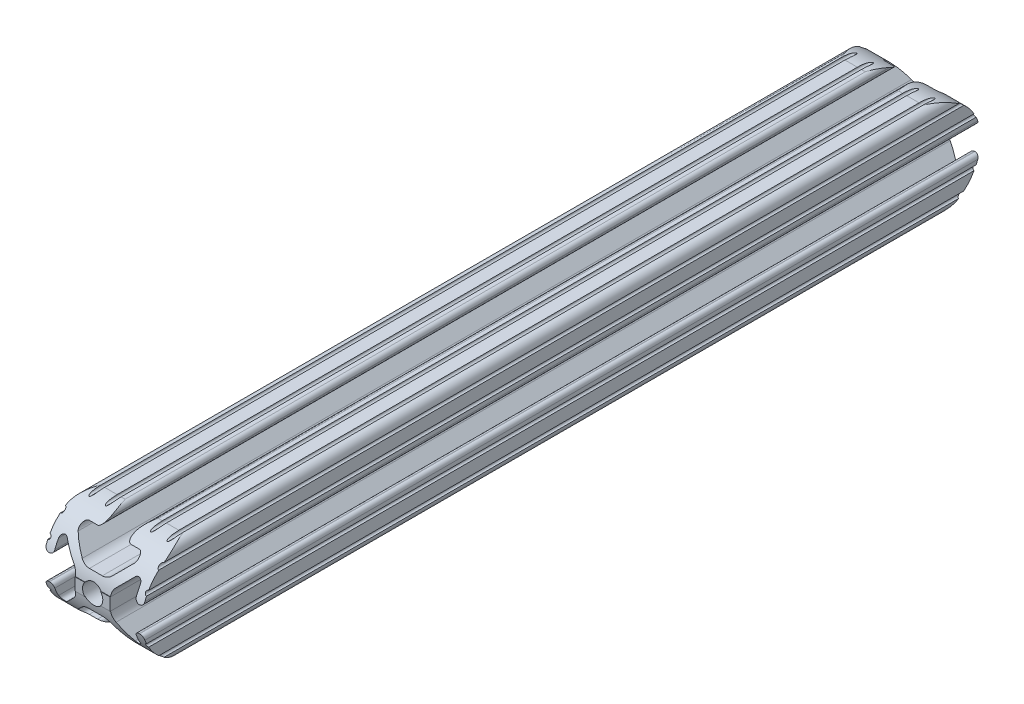
from build123d import *

# Parameters (mm, degrees)
SKETCH1_R               = 2.6035
BOSS_EXTRUDE1_DEPTH     = 107.95
CUT_EXTRUDE1_DEPTH      = 111.048284731
CUT_EXTRUDE1_DEPTH_BACK = 111.048284731
SKETCH2_R               = 3.175
CUT_EXTRUDE2_DEPTH      = 111.048284856
CUT_EXTRUDE2_DEPTH_BACK = 111.048284856


with BuildPart() as part:
    # Sketch1 → Boss-Extrude1 (new, symmetric)
    with BuildSketch(Plane.XY):
        with BuildLine():
            Line((-7.179650497, -8.645192506), (-3.952270251, -5.423690499))
            ThreePointArc((-3.952270251, -5.423690499), (-2.922936451, -4.736929036), (-1.709253557, -4.4958))
            Line((-1.709253557, -4.4958), (1.709253557, -4.4958))
            ThreePointArc((1.709253557, -4.4958), (2.922936451, -4.736929036), (3.952270251, -5.423690499))
            Line((3.952270251, -5.423690499), (7.179650497, -8.645192506))
            ThreePointArc((7.179650497, -8.645192506), (7.41473083, -9.822813117), (6.416408329, -10.4902))
            Line((6.416408329, -10.4902), (4.287512407, -10.4902))
            ThreePointArc((4.287512407, -10.4902), (3.54574862, -10.79744862), (3.2385, -11.539212407))
            Line((3.2385, -11.539212407), (3.2385, -11.650987593))
            ThreePointArc((3.2385, -11.650987593), (3.54574862, -12.39275138), (4.287512407, -12.7))
            Line((4.287512407, -12.7), (5.317126718, -12.7))
            ThreePointArc((5.317126718, -12.7), (5.825126718, -12.192), (6.333126718, -12.7))
            Line((6.333126718, -12.7), (9.550443118, -12.7))
            ThreePointArc((9.550443118, -12.7), (10.058366869, -12.192000006), (10.566443095, -12.699847501))
            ThreePointArc((10.566443095, -12.699847501), (12.082537762, -12.08250727), (12.699846982, -10.566399977))
            ThreePointArc((12.699846982, -10.566399977), (12.192000006, -10.058323491), (12.7, -9.5504))
            Line((12.7, -9.5504), (12.7, -6.3330836))
            ThreePointArc((12.7, -6.3330836), (12.192, -5.8250836), (12.7, -5.3170836))
            Line((12.7, -5.3170836), (12.7, -4.287469289))
            ThreePointArc((12.7, -4.287469289), (12.39275138, -3.545705502), (11.650987593, -3.238456882))
            Line((11.650987593, -3.238456882), (11.539212407, -3.238456882))
            ThreePointArc((11.539212407, -3.238456882), (10.79744862, -3.545705502), (10.4902, -4.287469289))
            Line((10.4902, -4.287469289), (10.4902, -6.402089023))
            ThreePointArc((10.4902, -6.402089023), (9.856505071, -7.351067942), (8.737131347, -7.129408934))
            Line((8.737131347, -7.129408934), (5.441005833, -3.840816462))
            ThreePointArc((5.441005833, -3.840816462), (4.750877967, -2.809883091), (4.5085, -1.593185507))
            Line((4.5085, -1.593185507), (4.5085, 1.593185507))
            ThreePointArc((4.5085, 1.593185507), (4.750877967, 2.809883091), (5.441005833, 3.840816462))
            Line((5.441005833, 3.840816462), (8.737131347, 7.129408934))
            ThreePointArc((8.737131347, 7.129408934), (9.856505071, 7.351067942), (10.4902, 6.402089023))
            Line((10.4902, 6.402089023), (10.4902, 4.287469289))
            ThreePointArc((10.4902, 4.287469289), (10.79744862, 3.545705502), (11.539212407, 3.238456882))
            Line((11.539212407, 3.238456882), (11.650987593, 3.238456882))
            ThreePointArc((11.650987593, 3.238456882), (12.39275138, 3.545705502), (12.7, 4.287469289))
            Line((12.7, 4.287469289), (12.7, 5.3170836))
            ThreePointArc((12.7, 5.3170836), (12.192, 5.8250836), (12.7, 6.3330836))
            Line((12.7, 6.3330836), (12.7, 9.5504))
            ThreePointArc((12.7, 9.5504), (12.192000006, 10.058323491), (12.699846982, 10.566399977))
            ThreePointArc((12.699846982, 10.566399977), (12.082537762, 12.08250727), (10.566443095, 12.699847501))
            ThreePointArc((10.566443095, 12.699847501), (10.058366869, 12.192000006), (9.550443118, 12.7))
            Line((9.550443118, 12.7), (6.333126718, 12.7))
            ThreePointArc((6.333126718, 12.7), (5.825126718, 12.192), (5.317126718, 12.7))
            Line((5.317126718, 12.7), (4.287512407, 12.7))
            ThreePointArc((4.287512407, 12.7), (3.54574862, 12.39275138), (3.2385, 11.650987593))
            Line((3.2385, 11.650987593), (3.2385, 11.539212407))
            ThreePointArc((3.2385, 11.539212407), (3.54574862, 10.79744862), (4.287512407, 10.4902))
            Line((4.287512407, 10.4902), (6.476788598, 10.4902))
            ThreePointArc((6.476788598, 10.4902), (7.432222385, 9.85140422), (7.207036008, 8.724370562))
            Line((7.207036008, 8.724370562), (3.898272566, 5.423169045))
            ThreePointArc((3.898272566, 5.423169045), (2.869120213, 4.736787962), (1.655778399, 4.4958))
            Line((1.655778399, 4.4958), (-1.655778399, 4.4958))
            ThreePointArc((-1.655778399, 4.4958), (-2.869120213, 4.736787962), (-3.898272566, 5.423169045))
            Line((-3.898272566, 5.423169045), (-7.207036008, 8.724370562))
            ThreePointArc((-7.207036008, 8.724370562), (-7.432222385, 9.85140422), (-6.476788598, 10.4902))
            Line((-6.476788598, 10.4902), (-4.287512407, 10.4902))
            ThreePointArc((-4.287512407, 10.4902), (-3.54574862, 10.79744862), (-3.2385, 11.539212407))
            Line((-3.2385, 11.539212407), (-3.2385, 11.650987593))
            ThreePointArc((-3.2385, 11.650987593), (-3.54574862, 12.39275138), (-4.287512407, 12.7))
            Line((-4.287512407, 12.7), (-5.317126718, 12.7))
            ThreePointArc((-5.317126718, 12.7), (-5.825126718, 12.192), (-6.333126718, 12.7))
            Line((-6.333126718, 12.7), (-9.550443118, 12.7))
            ThreePointArc((-9.550443118, 12.7), (-10.058366869, 12.192000006), (-10.566443095, 12.699847501))
            ThreePointArc((-10.566443095, 12.699847501), (-12.082537762, 12.08250727), (-12.699846982, 10.566399977))
            ThreePointArc((-12.699846982, 10.566399977), (-12.192000006, 10.058323491), (-12.7, 9.5504))
            Line((-12.7, 9.5504), (-12.7, 6.3330836))
            ThreePointArc((-12.7, 6.3330836), (-12.192, 5.8250836), (-12.7, 5.3170836))
            Line((-12.7, 5.3170836), (-12.7, 4.287469289))
            ThreePointArc((-12.7, 4.287469289), (-12.39275138, 3.545705502), (-11.650987593, 3.238456882))
            Line((-11.650987593, 3.238456882), (-11.539212407, 3.238456882))
            ThreePointArc((-11.539212407, 3.238456882), (-10.79744862, 3.545705502), (-10.4902, 4.287469289))
            Line((-10.4902, 4.287469289), (-10.4902, 6.402089023))
            ThreePointArc((-10.4902, 6.402089023), (-9.856505071, 7.351067942), (-8.737131347, 7.129408934))
            Line((-8.737131347, 7.129408934), (-5.441005833, 3.840816462))
            ThreePointArc((-5.441005833, 3.840816462), (-4.750877967, 2.809883091), (-4.5085, 1.593185507))
            Line((-4.5085, 1.593185507), (-4.5085, -1.593185507))
            ThreePointArc((-4.5085, -1.593185507), (-4.750877967, -2.809883091), (-5.441005833, -3.840816462))
            Line((-5.441005833, -3.840816462), (-8.737131347, -7.129408934))
            ThreePointArc((-8.737131347, -7.129408934), (-9.856505071, -7.351067942), (-10.4902, -6.402089023))
            Line((-10.4902, -6.402089023), (-10.4902, -4.287469289))
            ThreePointArc((-10.4902, -4.287469289), (-10.79744862, -3.545705502), (-11.539212407, -3.238456882))
            Line((-11.539212407, -3.238456882), (-11.650987593, -3.238456882))
            ThreePointArc((-11.650987593, -3.238456882), (-12.39275138, -3.545705502), (-12.7, -4.287469289))
            Line((-12.7, -4.287469289), (-12.7, -5.3170836))
            ThreePointArc((-12.7, -5.3170836), (-12.192, -5.8250836), (-12.7, -6.3330836))
            Line((-12.7, -6.3330836), (-12.7, -9.5504))
            ThreePointArc((-12.7, -9.5504), (-12.192000006, -10.058323491), (-12.699846982, -10.566399977))
            ThreePointArc((-12.699846982, -10.566399977), (-12.082537762, -12.08250727), (-10.566443095, -12.699847501))
            ThreePointArc((-10.566443095, -12.699847501), (-10.058366869, -12.192000006), (-9.550443118, -12.7))
            Line((-9.550443118, -12.7), (-6.333126718, -12.7))
            ThreePointArc((-6.333126718, -12.7), (-5.825126718, -12.192), (-5.317126718, -12.7))
            Line((-5.317126718, -12.7), (-4.287512407, -12.7))
            ThreePointArc((-4.287512407, -12.7), (-3.54574862, -12.39275138), (-3.2385, -11.650987593))
            Line((-3.2385, -11.650987593), (-3.2385, -11.539212407))
            ThreePointArc((-3.2385, -11.539212407), (-3.54574862, -10.79744862), (-4.287512407, -10.4902))
            Line((-4.287512407, -10.4902), (-6.416408329, -10.4902))
            ThreePointArc((-6.416408329, -10.4902), (-7.41473083, -9.822813117), (-7.179650497, -8.645192506))
        make_face()
        Circle(SKETCH1_R, mode=Mode.SUBTRACT)
    extrude(amount=BOSS_EXTRUDE1_DEPTH, both=True)

    # Sketch2 → Cut-Extrude1 (cut, two sides: drawn at the far end of the back side and taken through both)
    with BuildSketch(Plane(origin=(4.5085, 0, 0), x_dir=(0, 0, -1), z_dir=(1, 0, 0)).offset(-CUT_EXTRUDE1_DEPTH_BACK)):
        with BuildLine():
            Line((-107.849673009, -1.593185507), (-107.95, -1.593185507))
            Line((-107.95, -1.593185507), (-107.95, -12.7))
            Line((-107.95, -12.7), (-95.25, -12.7))
            ThreePointArc((-95.25, -12.7), (-103.648111218, -9.52689498), (-107.849673009, -1.593185507))
        make_face()
        with BuildLine():
            Line((-107.95, 1.593185507), (-107.849673009, 1.593185507))
            ThreePointArc((-107.849673009, 1.593185507), (-103.671429601, 9.506288628), (-95.312237014, 12.699847501))
            Line((-95.312237014, 12.699847501), (-95.312237014, 13.97))
            Line((-95.312237014, 13.97), (-107.95, 13.97))
            Line((-107.95, 13.97), (-107.95, 1.593185507))
        make_face()
        with Locations((-95.25, 0)):
            Circle(SKETCH2_R)
        with Locations((-69.85, 0)):
            Circle(SKETCH2_R)
    extrude(amount=CUT_EXTRUDE1_DEPTH + CUT_EXTRUDE1_DEPTH_BACK, mode=Mode.SUBTRACT)

    # Sketch3 → Cut-Extrude2 (cut, two sides: drawn at the far end of the back side and taken through both)
    with BuildSketch(Plane(origin=(4.5085, 0, 0), x_dir=(0, 0, -1), z_dir=(1, 0, 0)).offset(-CUT_EXTRUDE2_DEPTH_BACK)):
        with BuildLine():
            Line((107.95, 12.7), (95.25, 12.7))
            ThreePointArc((95.25, 12.7), (103.648111218, 9.52689498), (107.849673009, 1.593185507))
            Line((107.849673009, 1.593185507), (107.95, 1.593185507))
            Line((107.95, 1.593185507), (107.95, 12.7))
        make_face()
        with BuildLine():
            Line((107.95, -12.7), (107.95, -1.593185507))
            Line((107.95, -1.593185507), (107.849673009, -1.593185507))
            ThreePointArc((107.849673009, -1.593185507), (103.648111218, -9.52689498), (95.25, -12.7))
            Line((95.25, -12.7), (107.95, -12.7))
        make_face()
    extrude(amount=CUT_EXTRUDE2_DEPTH + CUT_EXTRUDE2_DEPTH_BACK, mode=Mode.SUBTRACT)


solid = part.part
